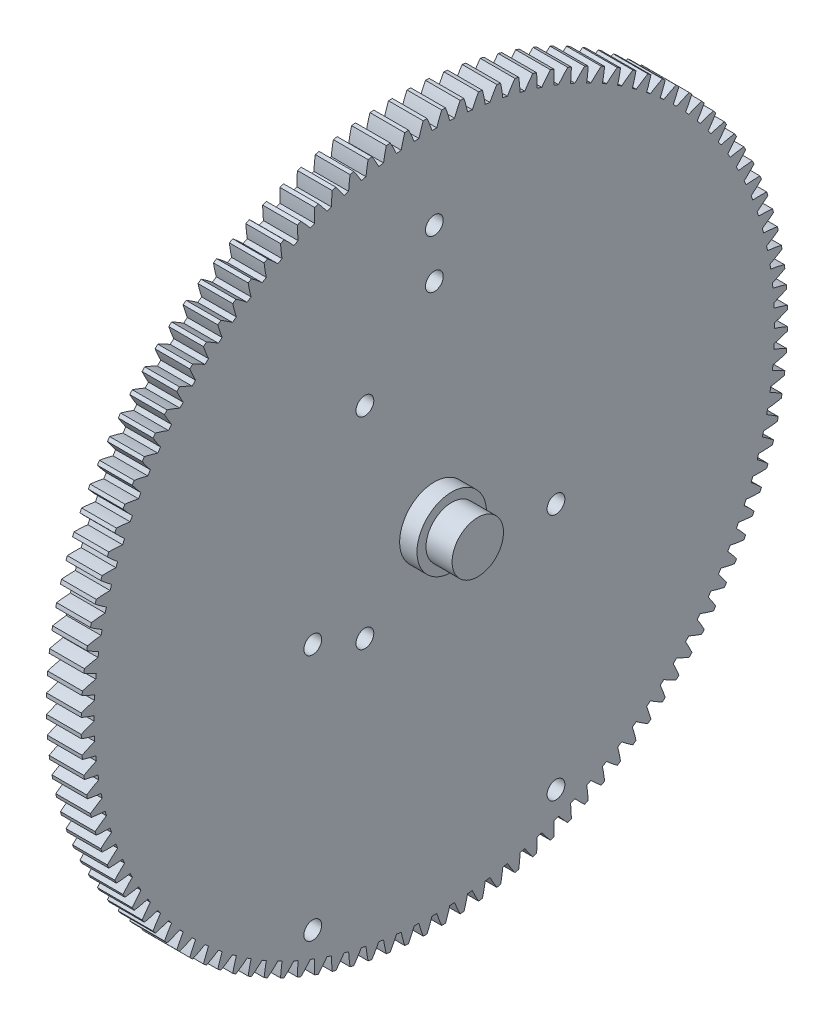
from build123d import *

# Parameters (mm, degrees)
BASPROSKE_W         = 12.7
BASPROSKE_H         = 129.116666667
TOOTHCUT_DEPTH      = 184.039660244
TEETHCUTS_COUNT     = 120
TEETHCUTS_ANGLE     = 357
SKETCH1_R           = 3.2512
CUT_EXTRUDE1_DEPTH  = 184.00052935
SKETCH2_R           = 12.699999999
BOSS_EXTRUDE1_DEPTH = 6.35
SKETCH3_R           = 9.397999999
BOSS_EXTRUDE2_DEPTH = 9.525


with BuildPart() as part:
    # BasProSke → Base-Revolve (revolve)
    with BuildSketch(Plane(origin=(0, 0, 0), x_dir=(1, 0, 0), z_dir=(0, 1, 0)), mode=Mode.PRIVATE) as base_revolve_sk:
        with Locations((6.35, 64.558333334)):
            Rectangle(BASPROSKE_W, BASPROSKE_H)
    revolve(base_revolve_sk.sketch.rotate(Axis((-10, 0, 0), (1, 0, 0)), 180), axis=Axis((-10, 0, 0), (1, 0, 0)))

    # TooCutSke → ToothCut (cut, through all)
    with BuildSketch(Plane(origin=(0, 0, 0), x_dir=(0, 0, -1), z_dir=(1, 0, 0))):
        with BuildLine():
            ThreePointArc((0.87803111, 124.349796826), (0, 124.352896667), (-0.87803111, 124.349796826))
            ThreePointArc((-0.87803111, 124.349796826), (-1.722818551, 126.754652472), (-2.687169681, 129.114106518))
            ThreePointArc((-2.687169681, 129.114106518), (0, 129.142066667), (2.687169681, 129.114106518))
            ThreePointArc((2.687169681, 129.114106518), (1.722818551, 126.754652472), (0.87803111, 124.349796826))
        make_face()
    toothcut = extrude(amount=TOOTHCUT_DEPTH, mode=Mode.SUBTRACT)

    # TeethCuts: ToothCut ×120 about axis
    teethcuts_axis = Axis((-10, 0, 0), (1, 0, 0))
    for i in range(1, TEETHCUTS_COUNT):
        add(toothcut.rotate(teethcuts_axis, i * TEETHCUTS_ANGLE / (TEETHCUTS_COUNT - 1)), mode=Mode.SUBTRACT)

    # Sketch1 → Cut-Extrude1 (cut, through all)
    with BuildSketch(Plane.ZY):
        with Locations((25.4, 49.53)):
            Circle(SKETCH1_R)
        with Locations((25.4, -24.13)):
            Circle(SKETCH1_R)
        with Locations((0, 93.98)):
            Circle(SKETCH1_R)
        with Locations((0, 76.2)):
            Circle(SKETCH1_R)
        with Locations((44.45, -16.51)):
            Circle(SKETCH1_R)
        with Locations((44.45, -106.934)):
            Circle(SKETCH1_R)
        with Locations(Location((-44.45, -106.934, 0), (0, 0, 180))):
            Circle(SKETCH1_R)
        with Locations(Location((-44.45, -16.51, 0), (0, 0, 180))):
            Circle(SKETCH1_R)
    extrude(amount=-CUT_EXTRUDE1_DEPTH, mode=Mode.SUBTRACT)

    # Sketch2 → Boss-Extrude1 (add)
    with BuildSketch(Plane(origin=(12.7, 0, 0), x_dir=(0, 0, -1), z_dir=(1, 0, 0))):
        with Locations(Location((1e-09, 0, 0), (0, 0, 180))):
            Circle(SKETCH2_R)
    extrude(amount=BOSS_EXTRUDE1_DEPTH)

    # Sketch3 → Boss-Extrude2 (add)
    with BuildSketch(Plane(origin=(19.05, 0, 0), x_dir=(0, 0, -1), z_dir=(1, 0, 0))):
        with Locations(Location((1e-09, 0, 0), (0, 0, 180))):
            Circle(SKETCH3_R)
    extrude(amount=BOSS_EXTRUDE2_DEPTH)


solid = part.part
